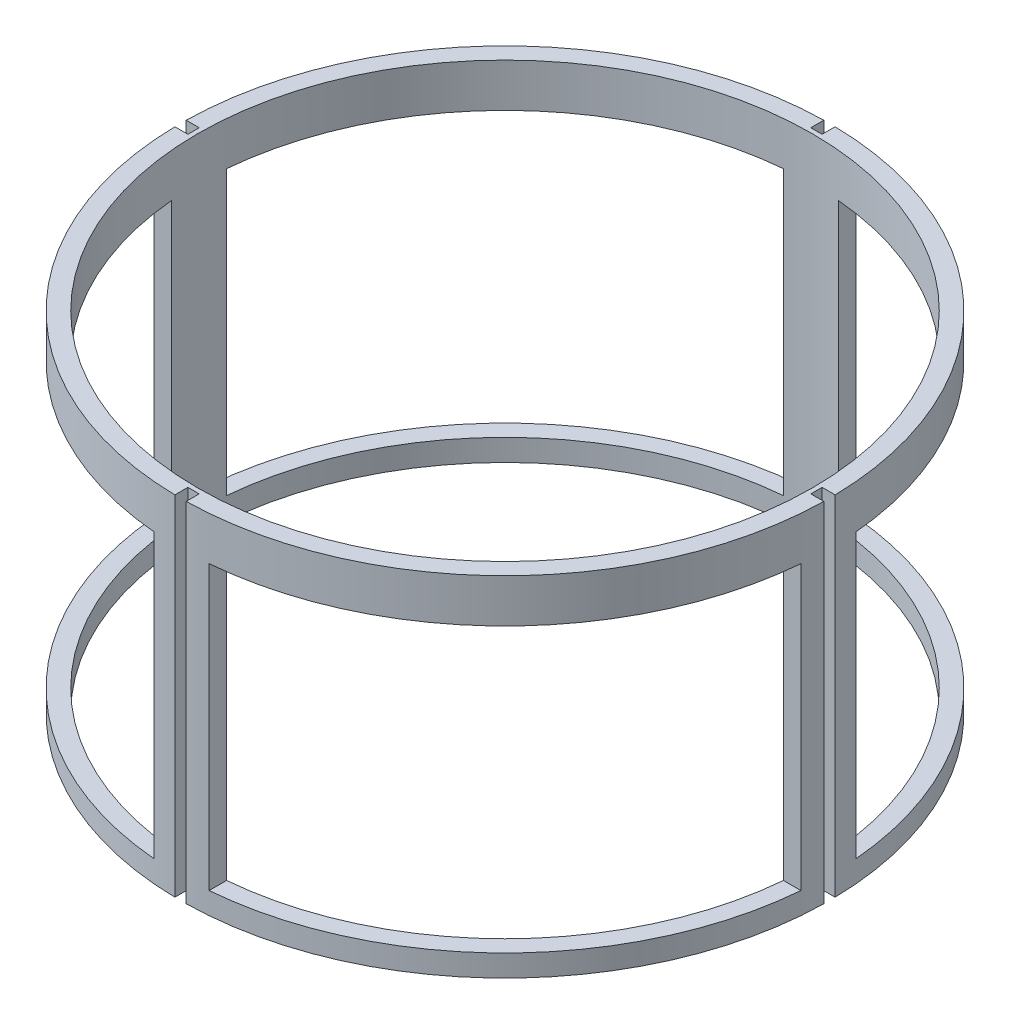
from build123d import *

# Parameters (mm, degrees)
SKETCH1_R           = 94.615
SKETCH1_R_2         = 89.535
BOSS_EXTRUDE1_DEPTH = 101.6
SKETCH5_W           = 3.302
SKETCH5_H           = 5.08
SKETCH5_W_2         = 5.08
SKETCH5_H_2         = 3.302
CUT_EXTRUDE1_DEPTH  = 101.6
CUT_EXTRUDE2_START  = -12.7
CUT_EXTRUDE2_DEPTH  = 82.55
CIRPATTERN1_COUNT   = 4


with BuildPart() as part:
    # Sketch1 → Boss-Extrude1 (new body)
    with BuildSketch(Plane(origin=(0, 0, 0), x_dir=(1, 0, 0), z_dir=(0, 1, 0))):
        Circle(SKETCH1_R)
        Circle(SKETCH1_R_2, mode=Mode.SUBTRACT)
    extrude(amount=-BOSS_EXTRUDE1_DEPTH)

    # Sketch5 → Cut-Extrude1 (cut)
    with BuildSketch(Plane(origin=(0, 0, 0), x_dir=(1, 0, 0), z_dir=(0, 1, 0))):
        with Locations((0, 93.345)):
            Rectangle(SKETCH5_W, SKETCH5_H)
        with Locations((0, -93.345)):
            Rectangle(SKETCH5_W, SKETCH5_H)
        with Locations((-93.345, 0)):
            Rectangle(SKETCH5_W_2, SKETCH5_H_2)
        with Locations((93.345, 0)):
            Rectangle(SKETCH5_W_2, SKETCH5_H_2)
    extrude(amount=-CUT_EXTRUDE1_DEPTH, mode=Mode.SUBTRACT)

    # Sketch7 → Cut-Extrude2 (cut)
    with BuildSketch(Plane(origin=(0, 0, 0), x_dir=(1, 0, 0), z_dir=(0, 1, 0)).offset(CUT_EXTRUDE2_START)):
        with BuildLine():
            Line((89.176791958, -8.001), (94.276095719, -8.001))
            ThreePointArc((94.276095719, -8.001), (66.902908102, -66.902908102), (8.001, -94.276095719))
            Line((8.001, -94.276095719), (8.001, -89.176791958))
            ThreePointArc((8.001, -89.176791958), (63.310805654, -63.310805654), (89.176791958, -8.001))
        make_face()
    cut_extrude2 = extrude(amount=-CUT_EXTRUDE2_DEPTH, mode=Mode.SUBTRACT)

    # CirPattern1: Cut-Extrude2 ×4 about axis
    cirpattern1_axis = Axis((0, 0, 0), (0, 1, 0))
    for i in range(1, CIRPATTERN1_COUNT):
        add(cut_extrude2.rotate(cirpattern1_axis, i * 360 / CIRPATTERN1_COUNT), mode=Mode.SUBTRACT)


solid = part.part
